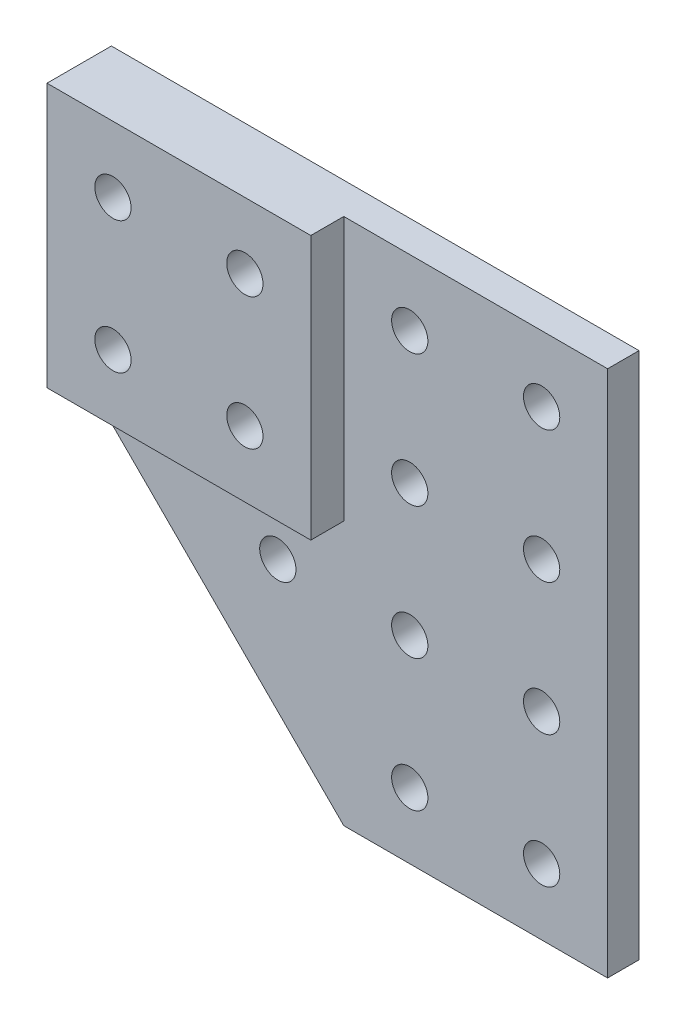
from build123d import *
from build123d.topology import SkipClean

# Parameters (mm, degrees)
SKETCH1_W                   = 40
SKETCH1_H                   = 40
BOSS_EXTRUDE1_DEPTH         = 4.7625
SKETCH1_3_W                 = 40
SKETCH1_3_H                 = 40
BOSS_EXTRUDE2_DEPTH         = 5
M5_CLEARANCE_HOLE1_D        = 5.5
BODY_MOVE_COPY1_OUTLINE_R   = 2.75
BODY_MOVE_COPY1_DEPTH       = 4.7625
BODY_MOVE_COPY1_START       = -5
BODY_MOVE_COPY1_2_OUTLINE_W = 40
BODY_MOVE_COPY1_2_OUTLINE_H = 40
BODY_MOVE_COPY1_2_OUTLINE_R = 2.75
BODY_MOVE_COPY1_2_DEPTH     = 0.2375
BODY_MOVE_COPY1_START_2     = -4.7625
BODY_MOVE_COPY1_3_OUTLINE_R = 2.75
BODY_MOVE_COPY1_3_DEPTH     = 4.7625
BODY_MOVE_COPY1_START_3     = 4.7625
BODY_MOVE_COPY1_4_OUTLINE_W = 40
BODY_MOVE_COPY1_4_OUTLINE_H = 40
BODY_MOVE_COPY1_4_OUTLINE_R = 2.75
BODY_MOVE_COPY1_4_DEPTH     = 0.2375


# Read off the part's stored shape, not the designer's step: Body-Move/Copy1
with BuildPart() as part:
    # Sketch1 → Boss-Extrude1 (new body)
    with BuildSketch(Plane.XY):
        with Locations((20, 60)):
            Rectangle(SKETCH1_W, SKETCH1_H)
        with Locations((60, 60)):
            Rectangle(SKETCH1_W, SKETCH1_H)
        with Locations((60, 20)):
            Rectangle(SKETCH1_W, SKETCH1_H)
        Polygon((40, 40), (0, 40), (40, 0), align=None)
    extrude(amount=BOSS_EXTRUDE1_DEPTH)

    # Sketch1<3> → Boss-Extrude2 (add)
    with BuildSketch(Plane.XY):
        with Locations((20, 60)):
            Rectangle(SKETCH1_3_W, SKETCH1_3_H)
    extrude(amount=-BOSS_EXTRUDE2_DEPTH)

    # M5 Clearance Hole1 (through all)
    with Locations(Plane.XY.offset(4.7625)):
        with Locations((10, 70), (30, 70), (50, 70), (70, 70), (30, 50), (50, 50), (70, 50), (30, 30), (50, 30), (70, 30), (50, 10), (70, 10), (10, 50)):
            Hole(M5_CLEARANCE_HOLE1_D / 2)

    # Body-Move/Copy1 outline → Body-Move/Copy1 (cut)
    with BuildSketch(Plane.XY):
        Polygon((40, 0), (80, 0), (80, 80), (40, 80), (40, 40), (0, 40), align=None)
        with Locations((30, 30)):
            Circle(BODY_MOVE_COPY1_OUTLINE_R, mode=Mode.SUBTRACT)
        with Locations((50, 10)):
            Circle(BODY_MOVE_COPY1_OUTLINE_R, mode=Mode.SUBTRACT)
        with Locations((70, 10)):
            Circle(BODY_MOVE_COPY1_OUTLINE_R, mode=Mode.SUBTRACT)
        with Locations((50, 30)):
            Circle(BODY_MOVE_COPY1_OUTLINE_R, mode=Mode.SUBTRACT)
        with Locations((70, 30)):
            Circle(BODY_MOVE_COPY1_OUTLINE_R, mode=Mode.SUBTRACT)
        with Locations((50, 50)):
            Circle(BODY_MOVE_COPY1_OUTLINE_R, mode=Mode.SUBTRACT)
        with Locations((70, 50)):
            Circle(BODY_MOVE_COPY1_OUTLINE_R, mode=Mode.SUBTRACT)
        with Locations((50, 70)):
            Circle(BODY_MOVE_COPY1_OUTLINE_R, mode=Mode.SUBTRACT)
        with Locations((70, 70)):
            Circle(BODY_MOVE_COPY1_OUTLINE_R, mode=Mode.SUBTRACT)
    extrude(amount=BODY_MOVE_COPY1_DEPTH, mode=Mode.SUBTRACT)

    # Body-Move_Copy1 2 outline → Body-Move_Copy1 2 (cut)
    with BuildSketch(Plane.XY.offset(BODY_MOVE_COPY1_START)):
        with Locations((20, 60)):
            Rectangle(BODY_MOVE_COPY1_2_OUTLINE_W, BODY_MOVE_COPY1_2_OUTLINE_H)
        with Locations((10, 50)):
            Circle(BODY_MOVE_COPY1_2_OUTLINE_R, mode=Mode.SUBTRACT)
        with Locations((30, 50)):
            Circle(BODY_MOVE_COPY1_2_OUTLINE_R, mode=Mode.SUBTRACT)
        with Locations((10, 70)):
            Circle(BODY_MOVE_COPY1_2_OUTLINE_R, mode=Mode.SUBTRACT)
        with Locations((30, 70)):
            Circle(BODY_MOVE_COPY1_2_OUTLINE_R, mode=Mode.SUBTRACT)
    extrude(amount=BODY_MOVE_COPY1_2_DEPTH, mode=Mode.SUBTRACT)

    # Body-Move_Copy1 3 outline → Body-Move_Copy1 3 (add)
    with BuildSketch(Plane.XY.offset(BODY_MOVE_COPY1_START_2)):
        Polygon((40, 0), (80, 0), (80, 80), (40, 80), (40, 40), (0, 40), align=None)
        with Locations((30, 30)):
            Circle(BODY_MOVE_COPY1_3_OUTLINE_R, mode=Mode.SUBTRACT)
        with Locations((50, 10)):
            Circle(BODY_MOVE_COPY1_3_OUTLINE_R, mode=Mode.SUBTRACT)
        with Locations((70, 10)):
            Circle(BODY_MOVE_COPY1_3_OUTLINE_R, mode=Mode.SUBTRACT)
        with Locations((50, 30)):
            Circle(BODY_MOVE_COPY1_3_OUTLINE_R, mode=Mode.SUBTRACT)
        with Locations((70, 30)):
            Circle(BODY_MOVE_COPY1_3_OUTLINE_R, mode=Mode.SUBTRACT)
        with Locations((50, 50)):
            Circle(BODY_MOVE_COPY1_3_OUTLINE_R, mode=Mode.SUBTRACT)
        with Locations((70, 50)):
            Circle(BODY_MOVE_COPY1_3_OUTLINE_R, mode=Mode.SUBTRACT)
        with Locations((50, 70)):
            Circle(BODY_MOVE_COPY1_3_OUTLINE_R, mode=Mode.SUBTRACT)
        with Locations((70, 70)):
            Circle(BODY_MOVE_COPY1_3_OUTLINE_R, mode=Mode.SUBTRACT)
    extrude(amount=BODY_MOVE_COPY1_3_DEPTH)

    # Body-Move_Copy1 4 outline → Body-Move_Copy1 4 (add)
    with SkipClean():  # the faces are left unmerged after this step: merging them gives an invalid solid
        with BuildSketch(Plane.XY.offset(BODY_MOVE_COPY1_START_3)):
            with Locations((20, 60)):
                Rectangle(BODY_MOVE_COPY1_4_OUTLINE_W, BODY_MOVE_COPY1_4_OUTLINE_H)
            with Locations((10, 50)):
                Circle(BODY_MOVE_COPY1_4_OUTLINE_R, mode=Mode.SUBTRACT)
            with Locations((30, 50)):
                Circle(BODY_MOVE_COPY1_4_OUTLINE_R, mode=Mode.SUBTRACT)
            with Locations((10, 70)):
                Circle(BODY_MOVE_COPY1_4_OUTLINE_R, mode=Mode.SUBTRACT)
            with Locations((30, 70)):
                Circle(BODY_MOVE_COPY1_4_OUTLINE_R, mode=Mode.SUBTRACT)
        extrude(amount=BODY_MOVE_COPY1_4_DEPTH)
    add(part.part.scale(1), mode=Mode.REPLACE)  # the faces are merged on a copy


solid = part.part
